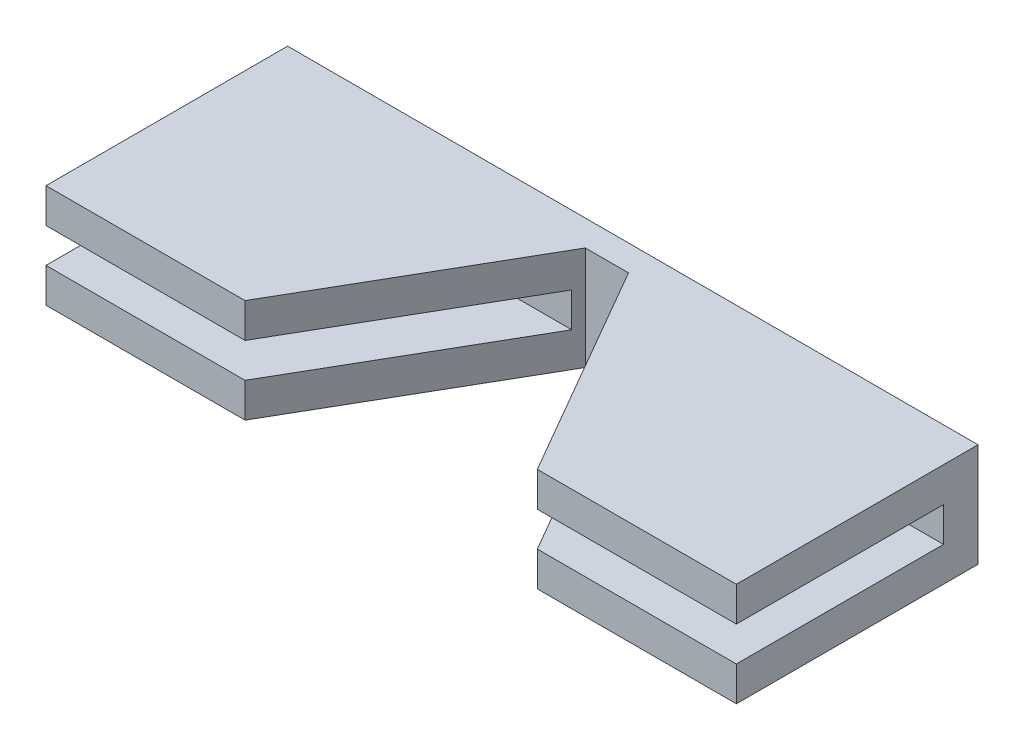
from build123d import *

# Parameters (mm, degrees)
BOSS_EXTRUDE1_DEPTH = 6
SHELL2_START        = 2
SHELL2_OUTLINE_W    = 20
SHELL2_OUTLINE_H    = 2
SHELL2_DEPTH        = 12


# Read off the part's stored shape, not the designer's step: Shell2
with BuildPart() as part:
    # Sketch1 → Boss-Extrude1 (new body)
    with BuildSketch(Plane(origin=(0, 0, 0), x_dir=(1, 0, 0), z_dir=(0, 1, 0))):
        Polygon((0, 0), (0, -14), (11.533121635, -14), (18.75, -1.5), (20, -1.5), (20, 0), align=None)
    extrude(amount=BOSS_EXTRUDE1_DEPTH)

    # Shell2 outline → Shell2 (cut)
    with BuildSketch(Plane.XY.offset(SHELL2_START)):
        with Locations((10, 3)):
            Rectangle(SHELL2_OUTLINE_W, SHELL2_OUTLINE_H)
    extrude(amount=SHELL2_DEPTH, mode=Mode.SUBTRACT)

    # Mirror1: part across plane


with BuildPart() as part_1:
    add(part.part)
    add(part.part.mirror(Plane(origin=(20, 0, 0), x_dir=(0, 0, 1), z_dir=(1, 0, 0))))


solid = part_1.part
